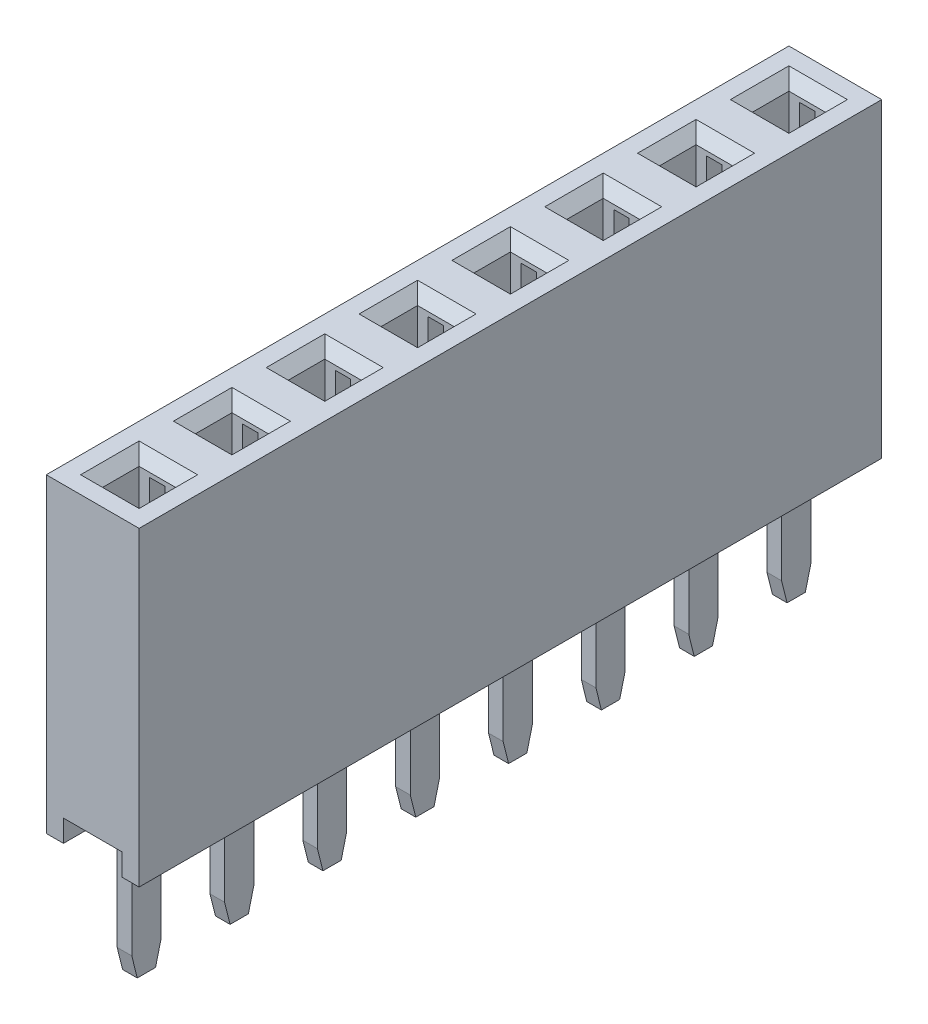
from build123d import *

# Parameters (mm, degrees)
DODANIE_WYCI_GNI_CIE1_DEPTH  = 2.54
SZKIC2_W                     = 1
SZKIC2_H                     = 1
WYTNIJ_WYCI_GNI_CIE1_DEPTH   = 6.5
SFAZOWANIE1_SIZE             = 0.3
SZKIC3_W                     = 0.42
SZKIC3_H                     = 2
WYTNIJ_WYCI_GNI_CIE2_DEPTH   = 7.48
F_1_0_START                  = 5.308321595
F_1_0_METAL_DEPTH            = 0.4
OBIEKT_PRZENIE_KOPIUJ4_ANGLE = 90
SZYK_LINIOWY1_COUNT          = 8
SZYK_LINIOWY1_PITCH          = 2.54


with BuildPart() as part:
    # Szkic1 → Dodanie-wyciągnięcie1 (new body)
    with BuildSketch(Plane.XY):
        Polygon((-60.643223432, 20.119077877), (-60.173223432, 20.119077877), (-60.173223432, 20.719077877), (-58.573223432, 20.719077877), (-58.573223432, 20.119077877), (-58.103223432, 20.119077877), (-58.103223432, 28.619077877), (-60.643223432, 28.619077877), align=None)
    extrude(amount=DODANIE_WYCI_GNI_CIE1_DEPTH)

    # Szkic2 → Wytnij-wyciągnięcie1 (cut)
    with BuildSketch(Plane(origin=(0, 28.619077877, 0), x_dir=(1, 0, 0), z_dir=(0, 1, 0))):
        with Locations((-59.373223432, -1.27)):
            Rectangle(SZKIC2_W, SZKIC2_H)
    extrude(amount=-WYTNIJ_WYCI_GNI_CIE1_DEPTH, mode=Mode.SUBTRACT)

    # Sfazowanie1
    sfazowanie1_edges = [part.edges().sort_by_distance(p)[0] for p in [
        (-59.873223432, 28.619077877, 1.27),
        (-59.373223432, 28.619077877, 1.77),
        (-58.873223432, 28.619077877, 1.27),
        (-59.373223432, 28.619077877, 0.77),
    ]]
    chamfer(sfazowanie1_edges, length=SFAZOWANIE1_SIZE)

    # Szkic3 → Wytnij-wyciągnięcie2 (cut)
    with BuildSketch(Plane.XZ.offset(-20.719077877)):
        with Locations((-59.373223432, 1.27)):
            Rectangle(SZKIC3_W, SZKIC3_H)
    extrude(amount=-WYTNIJ_WYCI_GNI_CIE2_DEPTH, mode=Mode.SUBTRACT)


with BuildPart() as body_2:
    # 1.0 metal: read off the stored shape, not the designer's step
    # 1.0 metal outline → 1.0 metal (new body)
    with BuildSketch(Plane.XY.offset(F_1_0_START)):
        with BuildLine():
            Line((-59.545144592, 19.33476682), (-59.045144592, 19.33476682))
            Line((-59.045144592, 19.33476682), (-58.895144592, 19.93476682))
            Line((-58.895144592, 19.93476682), (-58.895144592, 23.13476682))
            Line((-58.895144592, 23.13476682), (-58.695144592, 23.13476682))
            Line((-58.695144592, 23.13476682), (-58.295144592, 23.38476682))
            Line((-58.295144592, 23.38476682), (-58.295144592, 25.13476682))
            Line((-58.295144592, 25.13476682), (-58.481811258, 28.63476682))
            Line((-58.481811258, 28.63476682), (-58.845144592, 29.28476682))
            Line((-58.845144592, 29.28476682), (-58.995144592, 28.88476682))
            Line((-58.995144592, 28.88476682), (-58.795144592, 25.13476682))
            Line((-58.795144592, 25.13476682), (-58.795144592, 24.23476682))
            ThreePointArc((-58.795144592, 24.23476682), (-59.295144592, 23.73476682), (-59.795144592, 24.23476682))
            Line((-59.795144592, 24.23476682), (-59.795144592, 25.13476682))
            Line((-59.795144592, 25.13476682), (-59.595144592, 28.88476682))
            Line((-59.595144592, 28.88476682), (-59.745144592, 29.28476682))
            Line((-59.745144592, 29.28476682), (-60.108477925, 28.63476682))
            Line((-60.108477925, 28.63476682), (-60.295144592, 25.13476682))
            Line((-60.295144592, 25.13476682), (-60.295144592, 23.38476682))
            Line((-60.295144592, 23.38476682), (-59.895144592, 23.13476682))
            Line((-59.895144592, 23.13476682), (-59.695144592, 23.13476682))
            Line((-59.695144592, 23.13476682), (-59.695144592, 19.93476682))
            Line((-59.695144592, 19.93476682), (-59.545144592, 19.33476682))
        make_face()
    extrude(amount=F_1_0_METAL_DEPTH)


with BuildPart() as body_2_1:
    # Obiekt-Przenieś/Kopiuj4: read off the stored shape, not the designer's step
    # Obiekt-Przenieś/Kopiuj4: moved
    add(body_2.part.moved(Location((58.0251446, -2.4156889, -64.881545))).rotate(Axis((0, 0, 0), (0, 1, 0)), OBIEKT_PRZENIE_KOPIUJ4_ANGLE))


with BuildPart() as szyk_liniowy1_1:
    # Szyk liniowy1: pattern copy
    add(body_2_1.part.moved(Location(Vector(0, 0, -1) * (1 * SZYK_LINIOWY1_PITCH))))


with BuildPart() as szyk_liniowy1_2:
    # Szyk liniowy1: pattern copy
    add(body_2_1.part.moved(Location(Vector(0, 0, -1) * (2 * SZYK_LINIOWY1_PITCH))))


with BuildPart() as szyk_liniowy1_3:
    # Szyk liniowy1: pattern copy
    add(body_2_1.part.moved(Location(Vector(0, 0, -1) * (3 * SZYK_LINIOWY1_PITCH))))


with BuildPart() as szyk_liniowy1_4:
    # Szyk liniowy1: pattern copy
    add(body_2_1.part.moved(Location(Vector(0, 0, -1) * (4 * SZYK_LINIOWY1_PITCH))))


with BuildPart() as szyk_liniowy1_5:
    # Szyk liniowy1: pattern copy
    add(body_2_1.part.moved(Location(Vector(0, 0, -1) * (5 * SZYK_LINIOWY1_PITCH))))


with BuildPart() as szyk_liniowy1_6:
    # Szyk liniowy1: pattern copy
    add(body_2_1.part.moved(Location(Vector(0, 0, -1) * (6 * SZYK_LINIOWY1_PITCH))))


with BuildPart() as szyk_liniowy1_7:
    # Szyk liniowy1: pattern copy
    add(body_2_1.part.moved(Location(Vector(0, 0, -1) * (7 * SZYK_LINIOWY1_PITCH))))


with BuildPart() as szyk_liniowy1_8:
    # Szyk liniowy1: pattern copy
    add(part.part.moved(Location(Vector(0, 0, -1) * (1 * SZYK_LINIOWY1_PITCH))))


with BuildPart() as szyk_liniowy1_9:
    # Szyk liniowy1: pattern copy
    add(part.part.moved(Location(Vector(0, 0, -1) * (2 * SZYK_LINIOWY1_PITCH))))


with BuildPart() as szyk_liniowy1_10:
    # Szyk liniowy1: pattern copy
    add(part.part.moved(Location(Vector(0, 0, -1) * (3 * SZYK_LINIOWY1_PITCH))))


with BuildPart() as szyk_liniowy1_11:
    # Szyk liniowy1: pattern copy
    add(part.part.moved(Location(Vector(0, 0, -1) * (4 * SZYK_LINIOWY1_PITCH))))


with BuildPart() as szyk_liniowy1_12:
    # Szyk liniowy1: pattern copy
    add(part.part.moved(Location(Vector(0, 0, -1) * (5 * SZYK_LINIOWY1_PITCH))))


with BuildPart() as szyk_liniowy1_13:
    # Szyk liniowy1: pattern copy
    add(part.part.moved(Location(Vector(0, 0, -1) * (6 * SZYK_LINIOWY1_PITCH))))


with BuildPart() as szyk_liniowy1_14:
    # Szyk liniowy1: pattern copy
    add(part.part.moved(Location(Vector(0, 0, -1) * (7 * SZYK_LINIOWY1_PITCH))))


with BuildPart() as part_1:
    add(part.part)

    # Połącz1: union Szyk liniowy1_8, Szyk liniowy1_9, Szyk liniowy1_10, Szyk liniowy1_11, Szyk liniowy1_12, Szyk liniowy1_13, Szyk liniowy1_14
    add(szyk_liniowy1_8.part)
    add(szyk_liniowy1_9.part)
    add(szyk_liniowy1_10.part)
    add(szyk_liniowy1_11.part)
    add(szyk_liniowy1_12.part)
    add(szyk_liniowy1_13.part)
    add(szyk_liniowy1_14.part)


solid = Compound([body_2_1.part, szyk_liniowy1_1.part, szyk_liniowy1_2.part, szyk_liniowy1_3.part, szyk_liniowy1_4.part, szyk_liniowy1_5.part, szyk_liniowy1_6.part, szyk_liniowy1_7.part, part_1.part])
